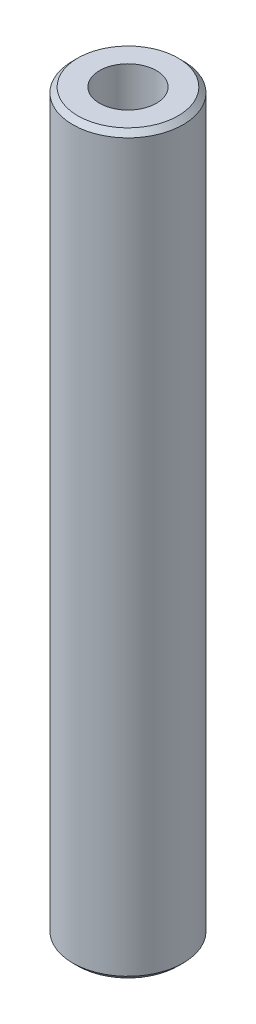
from build123d import *

# Parameters (mm, degrees)
SKETCH1_R           = 45
BOSS_EXTRUDE1_DEPTH = 600
SKETCH2_R           = 23.14111076
CUT_EXTRUDE1_DEPTH  = 604.365560834
CHAMFER1_SIZE       = 4.150811291


with BuildPart() as part:
    # Sketch1 → Boss-Extrude1 (new body)
    with BuildSketch(Plane(origin=(0, 0, 0), x_dir=(1, 0, 0), z_dir=(0, 1, 0))):
        Circle(SKETCH1_R)
    extrude(amount=BOSS_EXTRUDE1_DEPTH)

    # Sketch2 → Cut-Extrude1 (cut, through all)
    with BuildSketch(Plane(origin=(0, 0, 0), x_dir=(1, 0, 0), z_dir=(0, 1, 0))):
        Circle(SKETCH2_R)
    extrude(amount=CUT_EXTRUDE1_DEPTH, mode=Mode.SUBTRACT)

    # Chamfer1
    chamfer1_edges = [part.edges().sort_by_distance(p)[0] for p in [
        (-45, 600, 0),
        (-45, 0, 0),
    ]]
    chamfer(chamfer1_edges, length=CHAMFER1_SIZE)


solid = part.part
